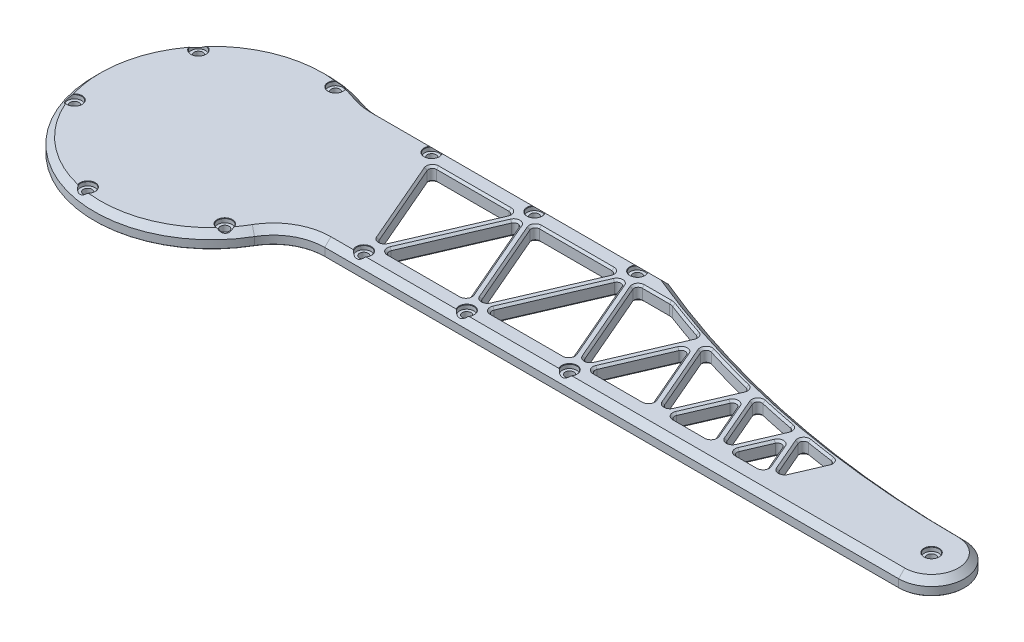
from build123d import *
from build123d.topology import SkipClean

# Parameters (mm, degrees)
SKETCH_1_R          = 2.1
SKETCH_1_R_2        = 6
EXTRUDE_1_DEPTH     = 7
EXTRUDE_START       = 1
SKETCH_4_R          = 8
SKETCH_4_R_2        = 6
EXTRUDE_2_DEPTH     = 1
SKETCH_5_R          = 3.5
CUT_EXTRUDE_1_DEPTH = 2
CUT_EXTRUDE_2_DEPTH = 7
SKETCH_6_3_R        = 47.5
CUT_EXTRUDE_3_DEPTH = 5
EXTRUDE_START_2     = -7
SKETCH_7_R          = 6
SKETCH_7_R_2        = 3.5
EXTRUDE_3_DEPTH     = 7
SKETCH_7_3_R        = 3.5
SKETCH_7_3_R_2      = 2.1
EXTRUDE_4_DEPTH     = 5
CHAMFER_2_SIZE      = 3
CHAMFER_3_SIZE      = 1
CHAMFER_4_SIZE      = 0.2


with BuildPart() as part:
    # 스케치1 → 보스-돌출1 (new body)
    with BuildSketch(Plane(origin=(0, 0, 0), x_dir=(1, 0, 0), z_dir=(0, 1, 0))):
        with BuildLine():
            ThreePointArc((49.363448016, -28.5), (58.51408311, -19.349364905), (71.01408311, -16))
            Line((71.01408311, -16), (350, -16))
            ThreePointArc((350, -16), (366, 0), (350, 16))
            ThreePointArc((350, 16), (258.217648755, 25.088243777), (170, 52))
            Line((170, 52), (28.19574436, 52))
            ThreePointArc((28.19574436, 52), (23.830555011, 52.384047409), (19.599480835, 53.524390244))
            ThreePointArc((19.599480835, 53.524390244), (-53.5814477, -19.442954054), (49.363448016, -28.5))
        make_face()
        with Locations(Location((60, 47, 0), (0, 0, 270))):
            Circle(SKETCH_1_R, mode=Mode.SUBTRACT)
        with Locations(Location((185, -11, 0), (0, 0, 270))):
            Circle(SKETCH_1_R, mode=Mode.SUBTRACT)
        with Locations(Location((160, 47, 0), (0, 0, 270))):
            Circle(SKETCH_1_R, mode=Mode.SUBTRACT)
        with Locations(Location((110, 47, 0), (0, 0, 270))):
            Circle(SKETCH_1_R, mode=Mode.SUBTRACT)
        with Locations(Location((85, -11, 0), (0, 0, 270))):
            Circle(SKETCH_1_R, mode=Mode.SUBTRACT)
        with Locations(Location((135, -11, 0), (0, 0, 270))):
            Circle(SKETCH_1_R, mode=Mode.SUBTRACT)
        with Locations(Location((-9.029705239, -51.210003157, 0), (0, 0, 270))):
            Circle(SKETCH_1_R, mode=Mode.SUBTRACT)
        with Locations(Location((-48.864016281, -17.785047453, 0), (0, 0, 270))):
            Circle(SKETCH_1_R, mode=Mode.SUBTRACT)
        with Locations(Location((-39.834311042, 33.424955704, 0), (0, 0, 270))):
            Circle(SKETCH_1_R, mode=Mode.SUBTRACT)
        with Locations(Location((9.029705239, 51.210003157, 0), (0, 0, 270))):
            Circle(SKETCH_1_R, mode=Mode.SUBTRACT)
        with Locations(Location((39.834311042, -33.424955704, 0), (0, 0, 270))):
            Circle(SKETCH_1_R, mode=Mode.SUBTRACT)
        with Locations(Location((350, 0, 0), (0, 0, 270))):
            Circle(SKETCH_1_R_2, mode=Mode.SUBTRACT)
    extrude(amount=EXTRUDE_1_DEPTH)

    # 스케치4 → 보스-돌출2 (add)
    with SkipClean():  # the faces are left unmerged after this step: merging them gives an invalid solid
        with BuildSketch(Plane.XZ.offset(EXTRUDE_START)):
            with Locations(Location((350, 0, 0), (0, 0, 90))):
                Circle(SKETCH_4_R)
            with Locations(Location((350, 0, 0), (0, 0, 270))):
                Circle(SKETCH_4_R_2, mode=Mode.SUBTRACT)
        extrude(amount=-EXTRUDE_2_DEPTH)

    # 스케치5 → 컷-돌출1 (cut)
    with SkipClean():  # the faces are left unmerged after this step: merging them gives an invalid solid
        with BuildSketch(Plane(origin=(0, 7, 0), x_dir=(1, 0, 0), z_dir=(0, 1, 0))):
            with Locations(Location((9.029705239, 51.210003157, 0), (0, 0, 270))):
                Circle(SKETCH_5_R)
            with Locations(Location((60, 47, 0), (0, 0, 270))):
                Circle(SKETCH_5_R)
            with Locations(Location((-39.834311042, 33.424955704, 0), (0, 0, 270))):
                Circle(SKETCH_5_R)
            with Locations(Location((-48.864016281, -17.785047453, 0), (0, 0, 270))):
                Circle(SKETCH_5_R)
            with Locations(Location((-9.029705239, -51.210003157, 0), (0, 0, 270))):
                Circle(SKETCH_5_R)
            with Locations(Location((39.834311042, -33.424955704, 0), (0, 0, 270))):
                Circle(SKETCH_5_R)
            with Locations(Location((85, -11, 0), (0, 0, 270))):
                Circle(SKETCH_5_R)
            with Locations(Location((110, 47, 0), (0, 0, 270))):
                Circle(SKETCH_5_R)
            with Locations(Location((160, 47, 0), (0, 0, 270))):
                Circle(SKETCH_5_R)
            with Locations(Location((135, -11, 0), (0, 0, 270))):
                Circle(SKETCH_5_R)
            with Locations(Location((185, -11, 0), (0, 0, 270))):
                Circle(SKETCH_5_R)
        extrude(amount=-CUT_EXTRUDE_1_DEPTH, mode=Mode.SUBTRACT)

    # 스케치6 → 컷-돌출2 (cut)
    with SkipClean():  # the faces are left unmerged after this step: merging them gives an invalid solid
        with BuildSketch(Plane.XZ):
            with BuildLine():
                Line((86.836648173, 1.686293783), (104.463646056, -39.208341305))
                ThreePointArc((104.463646056, -39.208341305), (104.297823635, -41.099245789), (102.626997883, -42))
                Line((102.626997883, -42), (67.373002117, -42))
                ThreePointArc((67.373002117, -42), (65.702176365, -41.099245789), (65.536353944, -39.208341305))
                Line((65.536353944, -39.208341305), (83.163351827, 1.686293783))
                ThreePointArc((83.163351827, 1.686293783), (85, 2.894635088), (86.836648173, 1.686293783))
            make_face()
            with BuildLine():
                ThreePointArc((90.536353944, 3.208341305), (90.702176365, 5.099245789), (92.373002117, 6))
                Line((92.373002117, 6), (127.626997883, 6))
                ThreePointArc((127.626997883, 6), (129.297823635, 5.099245789), (129.463646056, 3.208341305))
                Line((129.463646056, 3.208341305), (111.836648173, -37.686293783))
                ThreePointArc((111.836648173, -37.686293783), (110, -38.894635088), (108.163351827, -37.686293783))
                Line((108.163351827, -37.686293783), (90.536353944, 3.208341305))
            make_face()
            with BuildLine():
                Line((136.836648173, 1.686293783), (154.463646056, -39.208341305))
                ThreePointArc((154.463646056, -39.208341305), (154.297823635, -41.099245789), (152.626997883, -42))
                Line((152.626997883, -42), (117.373002117, -42))
                ThreePointArc((117.373002117, -42), (115.702176365, -41.099245789), (115.536353944, -39.208341305))
                Line((115.536353944, -39.208341305), (133.163351827, 1.686293783))
                ThreePointArc((133.163351827, 1.686293783), (135, 2.894635088), (136.836648173, 1.686293783))
            make_face()
            with BuildLine():
                ThreePointArc((140.536353944, 3.208341305), (140.702176365, 5.099245789), (142.373002117, 6))
                Line((142.373002117, 6), (177.626997883, 6))
                ThreePointArc((177.626997883, 6), (179.297823635, 5.099245789), (179.463646056, 3.208341305))
                Line((179.463646056, 3.208341305), (161.836648173, -37.686293783))
                ThreePointArc((161.836648173, -37.686293783), (160, -38.894635088), (158.163351827, -37.686293783))
                Line((158.163351827, -37.686293783), (140.536353944, 3.208341305))
            make_face()
            with BuildLine():
                ThreePointArc((186.836648173, 1.686293783), (185, 2.894635088), (183.163351827, 1.686293783))
                Line((183.163351827, 1.686293783), (165.536353944, -39.208341305))
                ThreePointArc((165.536353944, -39.208341305), (165.702176365, -41.099245789), (167.373002117, -42))
                Line((167.373002117, -42), (180.663057781, -42))
                ThreePointArc((180.663057781, -42), (181.563429624, -41.918264993), (182.434364708, -41.675732218))
                ThreePointArc((182.434364708, -41.675732218), (191.388255065, -38.386586413), (200.406652854, -35.27867168))
                ThreePointArc((200.406652854, -35.27867168), (201.599469687, -34.1987092), (201.610771017, -32.589671216))
                Line((201.610771017, -32.589671216), (186.836648173, 1.686293783))
            make_face()
            with BuildLine():
                ThreePointArc((190.536353944, 3.208341305), (190.702176365, 5.099245789), (192.373002117, 6))
                Line((192.373002117, 6), (216.396030347, 6))
                ThreePointArc((216.396030347, 6), (218.0668561, 5.099245789), (218.23267852, 3.208341305))
                Line((218.23267852, 3.208341305), (206.221164405, -24.658371442))
                ThreePointArc((206.221164405, -24.658371442), (204.384516232, -25.866712747), (202.547868059, -24.658371442))
                Line((202.547868059, -24.658371442), (190.536353944, 3.208341305))
            make_face()
            with BuildLine():
                ThreePointArc((208.635134721, -29.16332522), (208.982746158, -31.29018787), (211.059270124, -31.866752404))
                ThreePointArc((211.059270124, -31.866752404), (222.835737086, -28.414387587), (234.697805138, -25.268701896))
                ThreePointArc((234.697805138, -25.268701896), (236.003449007, -24.214758674), (236.046917603, -22.537375979))
                Line((236.046917603, -22.537375979), (225.605680637, 1.686293783))
                ThreePointArc((225.605680637, 1.686293783), (223.769032464, 2.894635088), (221.932384291, 1.686293783))
                Line((221.932384291, 1.686293783), (208.635134721, -29.16332522))
            make_face()
            with BuildLine():
                ThreePointArc((229.305386409, 3.208341305), (229.471208829, 5.099245789), (231.142034581, 6))
                Line((231.142034581, 6), (246.758724265, 6))
                ThreePointArc((246.758724265, 6), (248.429550018, 5.099245789), (248.595372438, 3.208341305))
                Line((248.595372438, 3.208341305), (240.787027596, -14.907018729))
                ThreePointArc((240.787027596, -14.907018729), (238.950379423, -16.115360034), (237.113731251, -14.907018729))
                Line((237.113731251, -14.907018729), (229.305386409, 3.208341305))
            make_face()
            with BuildLine():
                ThreePointArc((242.943754589, -20.008777016), (243.242499486, -22.079049614), (245.223432645, -22.750749666))
                ThreePointArc((245.223432645, -22.750749666), (253.753395897, -20.895701598), (262.316140476, -19.198385568))
                ThreePointArc((262.316140476, -19.198385568), (263.71128666, -18.171980489), (263.782032372, -16.441392351))
                Line((263.782032372, -16.441392351), (255.968374555, 1.686293783))
                ThreePointArc((255.968374555, 1.686293783), (254.131726383, 2.894635088), (252.29507821, 1.686293783))
                Line((252.29507821, 1.686293783), (242.943754589, -20.008777016))
            make_face()
            with BuildLine():
                ThreePointArc((259.668080327, 3.208341305), (259.833902747, 5.099245789), (261.5047285, 6))
                Line((261.5047285, 6), (272.082846612, 6))
                ThreePointArc((272.082846612, 6), (273.753672365, 5.099245789), (273.919494785, 3.208341305))
                Line((273.919494785, 3.208341305), (268.630435729, -9.062275706))
                ThreePointArc((268.630435729, -9.062275706), (266.793787556, -10.270617011), (264.957139383, -9.062275706))
                Line((264.957139383, -9.062275706), (259.668080327, 3.208341305))
            make_face()
            with BuildLine():
                ThreePointArc((272.769893179, -17.347548383), (279.318869214, -16.31081074), (285.88173446, -15.365976455))
                ThreePointArc((285.88173446, -15.365976455), (287.352264513, -14.367635529), (287.447269459, -12.592778548))
                Line((287.447269459, -12.592778548), (281.292496902, 1.686293783))
                ThreePointArc((281.292496902, 1.686293783), (279.455848729, 2.894635088), (277.619200557, 1.686293783))
                Line((277.619200557, 1.686293783), (270.606690643, -14.582729216))
                ThreePointArc((270.606690643, -14.582729216), (270.868171496, -16.60680339), (272.769893179, -17.347548383))
            make_face()
        extrude(amount=-CUT_EXTRUDE_2_DEPTH, mode=Mode.SUBTRACT)

    # 스케치6<3> → 컷-돌출3 (cut)
    with SkipClean():  # the faces are left unmerged after this step: merging them gives an invalid solid
        with BuildSketch(Plane.XZ):
            with Locations(Location((0, 0, 0), (0, 0, 270))):
                Circle(SKETCH_6_3_R)
        extrude(amount=-CUT_EXTRUDE_3_DEPTH, mode=Mode.SUBTRACT)

    # 스케치7 → 보스-돌출3 (add)
    with BuildSketch(Plane(origin=(0, 7, 0), x_dir=(1, 0, 0), z_dir=(0, 1, 0)).offset(EXTRUDE_START_2)):
        with Locations(Location((350, 0, 0), (0, 0, 90))):
            Circle(SKETCH_7_R)
        with Locations(Location((350, 0, 0), (0, 0, 270))):
            Circle(SKETCH_7_R_2, mode=Mode.SUBTRACT)
    extrude(amount=EXTRUDE_3_DEPTH)

    # 스케치7<3> → 보스-돌출4 (add)
    with BuildSketch(Plane(origin=(0, 7, 0), x_dir=(1, 0, 0), z_dir=(0, 1, 0)).offset(EXTRUDE_START_2)):
        with Locations(Location((350, 0, 0), (0, 0, 270))):
            Circle(SKETCH_7_3_R)
        with Locations(Location((350, 0, 0), (0, 0, 270))):
            Circle(SKETCH_7_3_R_2, mode=Mode.SUBTRACT)
    extrude(amount=EXTRUDE_4_DEPTH)

    # 모따기2
    # the kernel refuses this chamfer: 3 mm, written as the material it takes off along each edge
    with BuildSketch(Plane(origin=(350, 7, 0), x_dir=(0, 0, 1), z_dir=(-1, 0, 0))) as chamfer_2_piece_1:
        Polygon((16 - CHAMFER_2_SIZE, 0), (16, -CHAMFER_2_SIZE), (16, 0), align=None)
    revolve(axis=Axis((350, 7, 0), (0, 1, 0)), revolution_arc=180, mode=Mode.SUBTRACT)
    with BuildSketch(Plane(origin=(350, 7, -484), x_dir=(0, 0, 1), z_dir=(1, 0, 0))) as chamfer_2_piece_2:
        Polygon((468 + CHAMFER_2_SIZE, 0), (468, CHAMFER_2_SIZE), (468, 0), align=None)
    revolve(axis=Axis((350, 7, -484), (0, -1, 0)), revolution_arc=23.564418277, mode=Mode.SUBTRACT)
    with BuildSketch(Plane(origin=(177.715048964, 7, -52), x_dir=(0, 0.02749587661058648, 0.9996219169112968), z_dir=(-1, 0, 0))) as chamfer_2_piece_3:
        Polygon((CHAMFER_2_SIZE * 0.999621916911, -CHAMFER_2_SIZE * 0.0274958766106), (-CHAMFER_2_SIZE * 0.0274958766106, -CHAMFER_2_SIZE * 0.999621916911), (0, 0), align=None)
    extrude(amount=149.519304604, mode=Mode.SUBTRACT)
    with BuildSketch(Plane(origin=(28.19574436, 7, -77), x_dir=(0, 0, 1), z_dir=(1, 0, 0))) as chamfer_2_piece_4:
        Polygon((25 + CHAMFER_2_SIZE, 0), (25, CHAMFER_2_SIZE), (25, 0), align=None)
    revolve(axis=Axis((28.19574436, 7, -77), (0, -1, 0)), revolution_arc=20.111644304, mode=Mode.SUBTRACT)
    with BuildSketch(Plane(origin=(0, 7, 0), x_dir=(0.3438505409726296, 0, -0.9390243902438477), z_dir=(0.9390243902438477, 0, 0.3438505409726296))) as chamfer_2_piece_5:
        Polygon((57, -CHAMFER_2_SIZE), (57 - CHAMFER_2_SIZE, 0), (57, 0), align=None)
    revolve(axis=Axis((0, 7, 0), (0, 1, 0)), revolution_arc=260.111644304, mode=Mode.SUBTRACT)
    with BuildSketch(Plane(origin=(71.01408311, 7, 41), x_dir=(-0.8660254037844385, 0, -0.5000000000000003), z_dir=(-0.5000000000000003, 0, 0.8660254037844385))) as chamfer_2_piece_6:
        Polygon((25, CHAMFER_2_SIZE), (25 + CHAMFER_2_SIZE, 0), (25, 0), align=None)
    revolve(axis=Axis((71.01408311, 7, 41), (0, -1, 0)), revolution_arc=60, mode=Mode.SUBTRACT)
    with BuildSketch(Plane(origin=(71.01408311, 7, 16), x_dir=(0, -0.9996219169112968, 0.027495876610586778), z_dir=(1, 0, 0))) as chamfer_2_piece_7:
        Polygon((CHAMFER_2_SIZE * 0.999621916911, CHAMFER_2_SIZE * 0.0274958766106), (-CHAMFER_2_SIZE * 0.0274958766106, CHAMFER_2_SIZE * 0.999621916911), (0, 0), align=None)
    extrude(amount=278.98591689, mode=Mode.SUBTRACT)

    # 모따기3
    chamfer_3_edges = [part.edges().sort_by_distance(p)[0] for p in [
        (222.835737086, 0, -28.414387587),
        (208.982746158, 7, -31.29018787),
        (215.283759506, 7, -13.738515719),
        (223.769032464, 7, 2.894635088),
        (230.82629912, 0, -10.425541098),
        (236.003449007, 7, -24.214758674),
        (222.835737086, 7, -28.414387587),
        (230.82629912, 7, -10.425541098),
        (236.003449007, 0, -24.214758674),
        (223.769032464, 0, 2.894635088),
        (215.283759506, 0, -13.738515719),
        (208.982746158, 0, -31.29018787),
        (190.702176365, 0, 5.099245789),
        (204.384516232, 0, 6),
        (218.0668561, 7, 5.099245789),
        (212.226921462, 0, -10.725015068),
        (204.384516232, 0, -25.866712747),
        (196.542111002, 7, -10.725015068),
        (190.702176365, 7, 5.099245789),
        (204.384516232, 7, 6),
        (212.226921462, 7, -10.725015068),
        (204.384516232, 7, -25.866712747),
        (196.542111002, 0, -10.725015068),
        (218.0668561, 0, 5.099245789),
        (253.753395897, 0, -20.895701598),
        (243.242499486, 7, -22.079049614),
        (247.6194164, 7, -9.161241616),
        (254.131726383, 7, 2.894635088),
        (259.875203463, 0, -7.377549284),
        (263.71128666, 7, -18.171980489),
        (253.753395897, 7, -20.895701598),
        (259.875203463, 7, -7.377549284),
        (263.71128666, 0, -18.171980489),
        (254.131726383, 0, 2.894635088),
        (247.6194164, 0, -9.161241616),
        (243.242499486, 0, -22.079049614),
        (229.471208829, 0, 5.099245789),
        (238.950379423, 0, 6),
        (248.429550018, 7, 5.099245789),
        (244.691200017, 0, -5.849338712),
        (238.950379423, 0, -16.115360034),
        (233.20955883, 7, -5.849338712),
        (229.471208829, 7, 5.099245789),
        (238.950379423, 7, 6),
        (244.691200017, 7, -5.849338712),
        (238.950379423, 7, -16.115360034),
        (233.20955883, 0, -5.849338712),
        (248.429550018, 0, 5.099245789),
        (145.650147114, 0, -18.761023761),
        (154.297823635, 0, -41.099245789),
        (135, 7, -42),
        (115.702176365, 0, -41.099245789),
        (124.349852886, 7, -18.761023761),
        (135, 7, 2.894635088),
        (145.650147114, 7, -18.761023761),
        (154.297823635, 7, -41.099245789),
        (115.702176365, 7, -41.099245789),
        (135, 0, 2.894635088),
        (124.349852886, 0, -18.761023761),
        (135, 0, -42),
        (90.702176365, 0, 5.099245789),
        (110, 0, 6),
        (129.297823635, 7, 5.099245789),
        (120.650147114, 7, -17.238976239),
        (110, 0, -38.894635088),
        (99.349852886, 7, -17.238976239),
        (90.702176365, 7, 5.099245789),
        (110, 7, 6),
        (110, 7, -38.894635088),
        (99.349852886, 0, -17.238976239),
        (120.650147114, 0, -17.238976239),
        (129.297823635, 0, 5.099245789),
        (174.018029949, 0, -42),
        (165.702176365, 0, -41.099245789),
        (174.349852886, 7, -18.761023761),
        (185, 7, 2.894635088),
        (194.223709595, 0, -15.451688716),
        (201.599469687, 7, -34.1987092),
        (191.388255065, 0, -38.386586413),
        (181.563429624, 7, -41.918264993),
        (174.018029949, 7, -42),
        (165.702176365, 7, -41.099245789),
        (194.223709595, 7, -15.451688716),
        (191.388255065, 7, -38.386586413),
        (181.563429624, 0, -41.918264993),
        (201.599469687, 0, -34.1987092),
        (185, 0, 2.894635088),
        (174.349852886, 0, -18.761023761),
        (140.702176365, 0, 5.099245789),
        (160, 0, 6),
        (179.297823635, 7, 5.099245789),
        (170.650147114, 0, -17.238976239),
        (160, 0, -38.894635088),
        (149.349852886, 7, -17.238976239),
        (140.702176365, 7, 5.099245789),
        (160, 7, 6),
        (170.650147114, 7, -17.238976239),
        (160, 7, -38.894635088),
        (149.349852886, 0, -17.238976239),
        (179.297823635, 0, 5.099245789),
        (279.318869214, 0, -16.31081074),
        (270.868171496, 7, -16.60680339),
        (274.1129456, 7, -6.448217716),
        (279.455848729, 7, 2.894635088),
        (284.369883181, 0, -5.453242382),
        (287.352264513, 7, -14.367635529),
        (279.318869214, 7, -16.31081074),
        (284.369883181, 7, -5.453242382),
        (287.352264513, 0, -14.367635529),
        (279.455848729, 0, 2.894635088),
        (274.1129456, 0, -6.448217716),
        (270.868171496, 0, -16.60680339),
        (259.833902747, 0, 5.099245789),
        (266.793787556, 0, 6),
        (273.753672365, 7, 5.099245789),
        (271.274965257, 0, -2.9269672),
        (266.793787556, 0, -10.270617011),
        (262.312609855, 7, -2.9269672),
        (259.833902747, 7, 5.099245789),
        (266.793787556, 7, 6),
        (271.274965257, 7, -2.9269672),
        (266.793787556, 7, -10.270617011),
        (262.312609855, 0, -2.9269672),
        (273.753672365, 0, 5.099245789),
        (95.650147114, 0, -18.761023761),
        (104.297823635, 7, -41.099245789),
        (85, 7, -42),
        (65.702176365, 0, -41.099245789),
        (74.349852886, 7, -18.761023761),
        (85, 7, 2.894635088),
        (95.650147114, 7, -18.761023761),
        (65.702176365, 7, -41.099245789),
        (85, 0, 2.894635088),
        (74.349852886, 0, -18.761023761),
        (85, 0, -42),
        (104.297823635, 0, -41.099245789),
        (0, 5, 47.5),
        (0, 0, 47.5),
    ]]
    chamfer(chamfer_3_edges, length=CHAMFER_3_SIZE)

    # 모따기4
    chamfer_4_edges = [part.edges().sort_by_distance(p)[0] for p in [
        (350, 7, -3.5),
        (185, 7, 7.5),
        (135, 7, 7.5),
        (85, 7, 7.5),
        (37.153155491, 7, 31.17519907),
        (-8.421936617, 7, 47.763176021),
        (-45.735601993, 7, 16.215645005),
        (-36.340323571, 7, -33.219890948),
        (5.816567272, 7, -49.822291224),
        (56.897581589, 7, -45.379814825),
        (106.897581589, 7, -45.379814825),
        (163.102418411, 7, -45.379814825),
        (58.51408311, 0, 19.349364905),
        (-53.5814477, 0, 19.442954054),
        (23.830555011, 0, -52.384047409),
        (99.09787218, 0, -52),
        (210.507041555, 0, 16),
        (258.217648755, 0, -25.088243777),
        (366, 0, 0),
        (350, -1, 6),
        (350, -1, -8),
    ]]
    chamfer(chamfer_4_edges, length=CHAMFER_4_SIZE)


solid = part.part
